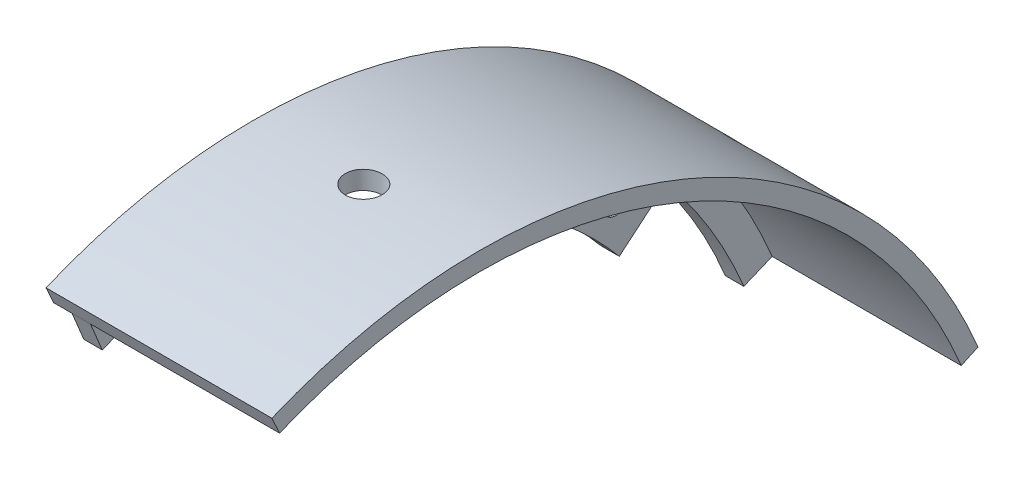
from build123d import *

# Parameters (mm, degrees)
SKETCH5_R                = 2
BOSS_EXTRUDE2_DEPTH      = 3
BOSS_EXTRUDE3_DEPTH      = 30.8
BOSS_EXTRUDE3_DEPTH_BACK = 6
CUT_EXTRUDE1_START       = 84.947042212
CUT_EXTRUDE1_DEPTH       = 3.052957992
CIRPATTERN1_COUNT        = 8


# Read off the part's stored shape, not the designer's step: Cut-Extrude1
with BuildPart() as part:
    # Sketch5 → Boss-Extrude2 (new body)
    with BuildSketch(Plane(origin=(0, 0, 0), x_dir=(0, 0, -1), z_dir=(1, 0, 0))):
        with BuildLine():
            Line((-32.528091751, 78.529760263), (-30.614674589, 73.910362601))
            ThreePointArc((-30.614674589, 73.910362601), (-19.014871386, 77.707365585), (-6.97245942, 79.695575847))
            Line((-6.97245942, 79.695575847), (-6.100901992, 69.733628866))
            ThreePointArc((-6.100901992, 69.733628866), (0, 70), (6.100901992, 69.733628866))
            Line((6.100901992, 69.733628866), (6.97245942, 79.695575847))
            ThreePointArc((6.97245942, 79.695575847), (30.614674589, 73.910362601), (51.423008775, 61.28355545))
            Line((51.423008775, 61.28355545), (44.995132678, 53.623111018))
            ThreePointArc((44.995132678, 53.623111018), (49.497474683, 49.497474683), (53.623111018, 44.995132678))
            Line((53.623111018, 44.995132678), (61.28355545, 51.423008775))
            ThreePointArc((61.28355545, 51.423008775), (68.392949654, 41.501860653), (73.910362601, 30.614674589))
            Line((73.910362601, 30.614674589), (78.529760263, 32.528091751))
            ThreePointArc((78.529760263, 32.528091751), (32.528091751, 78.529760263), (-32.528091751, 78.529760263))
        make_face()
        with Locations((0, 75)):
            Circle(SKETCH5_R, mode=Mode.SUBTRACT)
        with Locations((53.033008589, 53.033008589)):
            Circle(SKETCH5_R, mode=Mode.SUBTRACT)
    extrude(amount=BOSS_EXTRUDE2_DEPTH)

    # Sketch6 → Boss-Extrude3 (add, two sides: drawn at the far end of the back side and taken through both)
    with BuildSketch(Plane(origin=(3, 0, 0), x_dir=(0, 0, -1), z_dir=(1, 0, 0)).offset(-BOSS_EXTRUDE3_DEPTH_BACK)):
        with BuildLine():
            Line((-33.776344001, 81.259821474), (-32.528091751, 78.529760263))
            ThreePointArc((-32.528091751, 78.529760263), (32.528091751, 78.529760263), (78.529760263, 32.528091751))
            Line((78.529760263, 32.528091751), (81.259821474, 33.776344001))
            ThreePointArc((81.259821474, 33.776344001), (33.575888915, 81.342852689), (-33.776344001, 81.259821474))
        make_face()
    extrude(amount=BOSS_EXTRUDE3_DEPTH + BOSS_EXTRUDE3_DEPTH_BACK)

    # Cut-Extrude1 outline → Cut-Extrude1 (cut)
    with BuildSketch(Plane(origin=(0, 0, 0), x_dir=(1, 0, 0), z_dir=(0, 1, 0)).offset(CUT_EXTRUDE1_START)):
        with BuildLine():
            add(Edge.make_bspline(
                [(15, 3), (14.207155752, 3), (13.431935871, 2.67467752), (12.32503645, 1.56757614), (12.000417509, 0.784253557), (11.999583343, -0.781056107), (12.317849893, -1.559926049), (13.437373681, -2.680577823), (14.215788964, -2.999721613), (15.78207965, -3.000278008), (16.565523239, -2.676042446), (17.673000882, -1.570710817), (17.999196633, -0.794471212), (18.000800287, 0.788392407), (17.676438527, 1.565317466), (16.569584029, 2.673938655), (15.792844248, 3), (15, 3)],
                knots=[0, 0, 0, 0, 0.125, 0.125, 0.25, 0.25, 0.375, 0.375, 0.5, 0.5, 0.625, 0.625, 0.75, 0.75, 0.875, 0.875, 1, 1, 1, 1], degree=3))
        make_face()
    cut_extrude1 = extrude(amount=CUT_EXTRUDE1_DEPTH, mode=Mode.SUBTRACT)

    # CirPattern1: Cut-Extrude1 ×8 about axis, 6 skipped
    cirpattern1_axis = Axis((0, 0, 0), (1, 0, 0))
    add([cut_extrude1.rotate(cirpattern1_axis, i * 360 / CIRPATTERN1_COUNT) for i in range(1, CIRPATTERN1_COUNT) if i not in (1, 2, 3, 4, 5, 6)], mode=Mode.SUBTRACT)


solid = part.part
